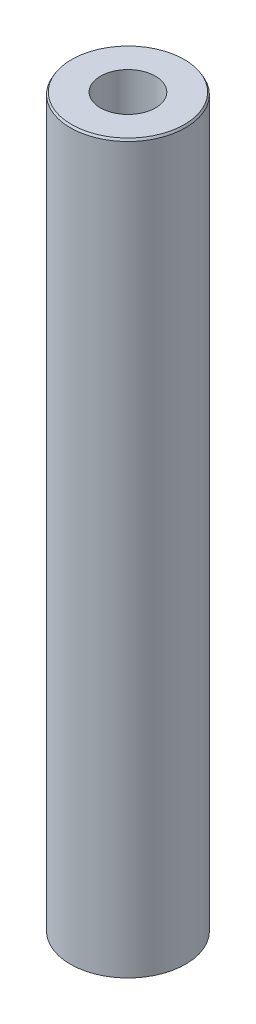
from build123d import *
from OCP.BRepFilletAPI import BRepFilletAPI_MakeChamfer

# Parameters (mm, degrees)
SKETCH1_R           = 47.5
BOSS_EXTRUDE1_DEPTH = 600
SKETCH2_R           = 22.680602413
CUT_EXTRUDE1_DEPTH  = 604.748706003
CHAMFER1_SIZE       = 1.771315276
CHAMFER1_SIZE2      = 1.022669352


with BuildPart() as part:
    # Sketch1 → Boss-Extrude1 (new body)
    with BuildSketch(Plane(origin=(0, 0, 0), x_dir=(1, 0, 0), z_dir=(0, 1, 0))):
        Circle(SKETCH1_R)
    extrude(amount=BOSS_EXTRUDE1_DEPTH)

    # Sketch2 → Cut-Extrude1 (cut, through all)
    with BuildSketch(Plane(origin=(0, 0, 0), x_dir=(1, 0, 0), z_dir=(0, 1, 0))):
        Circle(SKETCH2_R)
    extrude(amount=CUT_EXTRUDE1_DEPTH, mode=Mode.SUBTRACT)

    # Chamfer1: one chamfer whose edges measure the first distance from different faces: ONE call of the kernel's chamfer builder (chamfer() names one face for all edges)
    chamfer1_edges_1 = [part.edges().sort_by_distance(p)[0] for p in [
        (-47.5, 600, 0),
    ]]
    chamfer1_side_1 = [part.faces().sort_by_distance(p)[0] for p in [
        (-47.5, 300, 0),
    ]]
    chamfer1_edges_2 = [part.edges().sort_by_distance(p)[0] for p in [
        (-47.5, 0, 0),
    ]]
    chamfer1_side_2 = [part.faces().sort_by_distance(p)[0] for p in [
        (-46.156497116, 0, 0),
    ]]
    chamfer1 = BRepFilletAPI_MakeChamfer(part.part.solid().wrapped)
    for e in chamfer1_edges_1:
        chamfer1.Add(CHAMFER1_SIZE, CHAMFER1_SIZE2, e.wrapped, chamfer1_side_1[0].wrapped)  # the first distance lies on this face
    for e in chamfer1_edges_2:
        chamfer1.Add(CHAMFER1_SIZE, CHAMFER1_SIZE2, e.wrapped, chamfer1_side_2[0].wrapped)  # the first distance lies on this face
    add(Compound.cast(chamfer1.Shape()), mode=Mode.REPLACE)


solid = part.part
